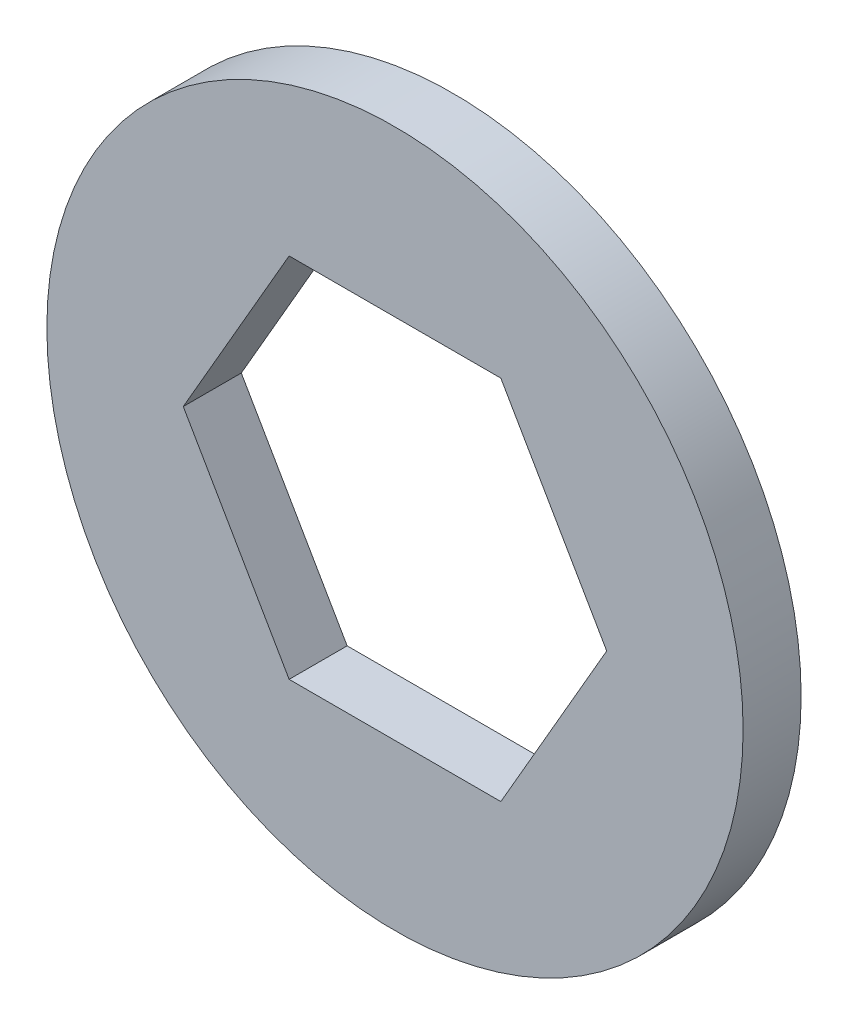
from build123d import *

# Parameters (mm, degrees)
SKETCH1_R           = 9.525
BOSS_EXTRUDE1_DEPTH = 0.79375


with BuildPart() as part:
    # Sketch1 → Boss-Extrude1 (new, symmetric)
    with BuildSketch(Plane.XY):
        Circle(SKETCH1_R)
        Polygon((-5.792555251, 0), (-2.896277625, -5.0165), (2.896277625, -5.0165), (5.792555251, 0), (2.896277625, 5.0165), (-2.896277625, 5.0165), align=None, mode=Mode.SUBTRACT)
    extrude(amount=BOSS_EXTRUDE1_DEPTH, both=True)


solid = part.part
